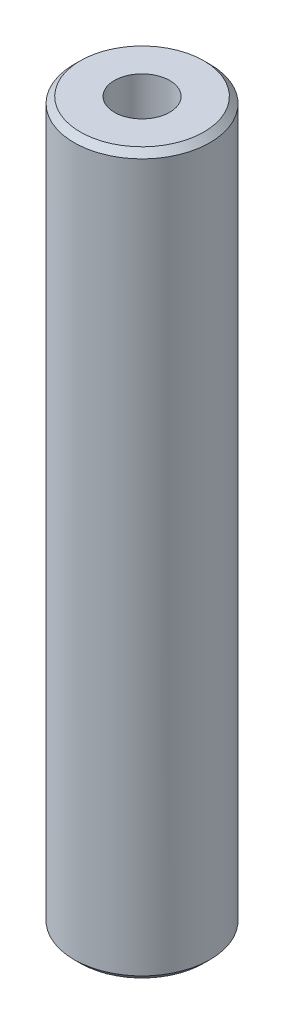
from build123d import *

# Parameters (mm, degrees)
SKETCH1_R           = 55
BOSS_EXTRUDE1_DEPTH = 582.94577416
SKETCH2_R           = 22.37314572
CUT_EXTRUDE1_DEPTH  = 589.112043416
CHAMFER1_SIZE       = 4.977522086


with BuildPart() as part:
    # Sketch1 → Boss-Extrude1 (new body)
    with BuildSketch(Plane(origin=(0, 0, 0), x_dir=(1, 0, 0), z_dir=(0, 1, 0))):
        Circle(SKETCH1_R)
    extrude(amount=BOSS_EXTRUDE1_DEPTH)

    # Sketch2 → Cut-Extrude1 (cut, through all)
    with BuildSketch(Plane(origin=(0, 0, 0), x_dir=(1, 0, 0), z_dir=(0, 1, 0))):
        Circle(SKETCH2_R)
    extrude(amount=CUT_EXTRUDE1_DEPTH, mode=Mode.SUBTRACT)

    # Chamfer1
    chamfer1_edges = [part.edges().sort_by_distance(p)[0] for p in [
        (-55, 582.94577416, 0),
        (-55, 0, 0),
    ]]
    chamfer(chamfer1_edges, length=CHAMFER1_SIZE)


solid = part.part
